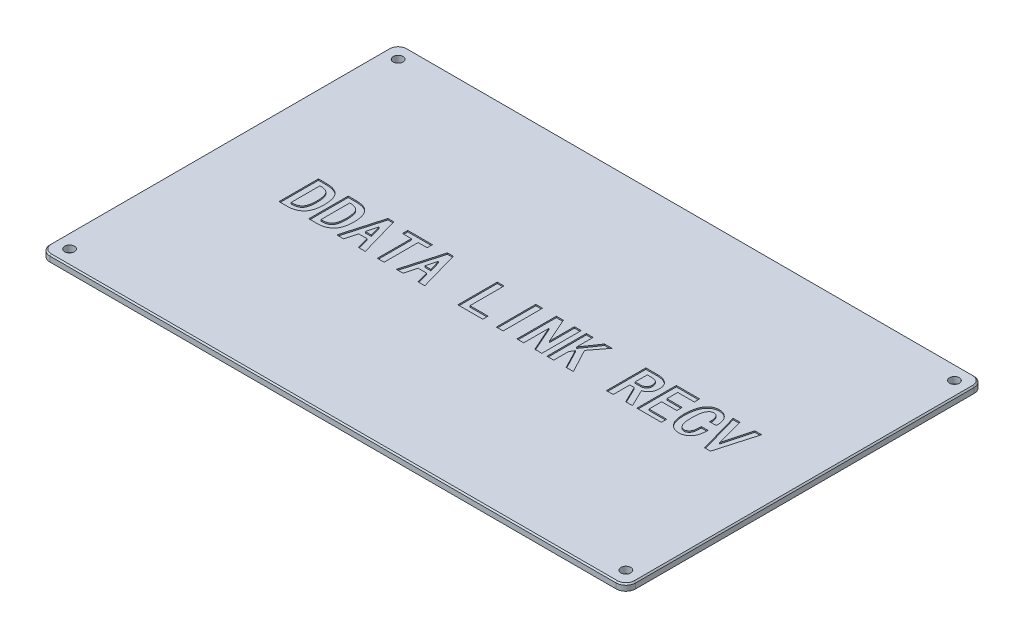
from build123d import *

# Parameters (mm, degrees)
SKETCH_1_W              = 180
SKETCH_1_H              = 110
EXTRUDE_1_DEPTH         = 2
SKETCH_2_R              = 1.5
CUT_EXTRUDE_1_DEPTH     = 2
FILLET_1_R              = 3
CHAMFER_1_SIZE          = 0.4
CUT_EXTRUDE_START       = -0.4
CUT_EXTRUDE_2_OUTLINE_W = 2.081871345
CUT_EXTRUDE_2_OUTLINE_H = 12.109161793
CUT_EXTRUDE_2_DEPTH     = 0.4


# Read off the part's stored shape, not the designer's step: 切除-拉伸2
with BuildPart() as part:
    # 草图1 → 凸台-拉伸1 (new body)
    with BuildSketch(Plane(origin=(0, 0, 0), x_dir=(1, 0, 0), z_dir=(0, 1, 0))):
        with Locations((90, 55)):
            Rectangle(SKETCH_1_W, SKETCH_1_H)
    extrude(amount=EXTRUDE_1_DEPTH)

    # 草图2 → 切除-拉伸1 (cut)
    with BuildSketch(Plane(origin=(0, 2, 0), x_dir=(1, 0, 0), z_dir=(0, 1, 0))):
        with Locations(Location((4.5, 105.5, 0), (0, 0, 270))):
            Circle(SKETCH_2_R)
        with Locations(Location((175.5, 105.5, 0), (0, 0, 270))):
            Circle(SKETCH_2_R)
        with Locations(Location((175.5, 4.5, 0), (0, 0, 270))):
            Circle(SKETCH_2_R)
        with Locations(Location((4.5, 4.5, 0), (0, 0, 270))):
            Circle(SKETCH_2_R)
    extrude(amount=-CUT_EXTRUDE_1_DEPTH, mode=Mode.SUBTRACT)

    # 圆角1
    fillet_1_edges = [part.edges().sort_by_distance(p)[0] for p in [
        (0, 1, -110),
        (180, 1, -110),
        (180, 1, 0),
        (0, 1, 0),
    ]]
    fillet(fillet_1_edges, radius=FILLET_1_R)

    # 倒角1
    chamfer_1_edges = [part.edges().sort_by_distance(p)[0] for p in [
        (0, 2, -55),
        (90, 2, -110),
        (90, 2, 0),
        (180, 2, -55),
        (179.121320344, 2, -0.878679656),
        (0.878679656, 2, -0.878679656),
        (179.121320344, 2, -109.121320344),
        (0.878679656, 2, -109.121320344),
    ]]
    chamfer(chamfer_1_edges, length=CHAMFER_1_SIZE)

    # 切除-拉伸2 outline → 切除-拉伸2 (cut)
    # profile 1 of 13: a face of its own
    with BuildSketch(Plane(origin=(0, 2, 0), x_dir=(1, 0, 0), z_dir=(0, 1, 0)).offset(CUT_EXTRUDE_START)):
        with BuildLine():
            add(Edge.make_bspline(
                [(150.95685727, 54.330020214), (150.948428937, 54.104573709), (150.932184848, 53.670066293), (150.862978184, 53.044455821), (150.76736325, 52.468824514), (150.634541592, 51.943961143), (150.472579151, 51.468953251), (150.277903446, 51.044851463), (150.05159863, 50.67039421), (149.78898881, 50.349533299), (149.502806077, 50.073047792), (149.20158679, 49.832073173), (148.881189049, 49.631791941), (148.547682408, 49.462140493), (148.193990079, 49.336657875), (147.825704445, 49.241020388), (147.439330699, 49.186351986), (147.176212548, 49.179501905), (147.04262725, 49.176024113)],
                knots=[0, 0, 0, 0, 0.092650065, 0.178566264, 0.258374813, 0.332177898, 0.400722959, 0.464258159, 0.523527298, 0.579945311, 0.634057603, 0.686750304, 0.73809523, 0.78902775, 0.840141494, 0.891933461, 0.945134531, 1, 1, 1, 1], degree=3))
            Line((150.95685727, 54.330020214), (148.872386835, 54.330020214))
            add(Edge.make_bspline(
                [(147.04262725, 50.816050104), (147.099105368, 50.81795417), (147.211202775, 50.821733349), (147.377686102, 50.855334281), (147.541847547, 50.905879587), (147.700251061, 50.983169253), (147.855546758, 51.078569957), (148.009941471, 51.191969399), (148.155863045, 51.332431625), (148.307191367, 51.488238472), (148.443752927, 51.683955185), (148.560556173, 51.925177341), (148.657307344, 52.212819236), (148.7362325, 52.546198895), (148.798163023, 52.925766987), (148.839710279, 53.352036708), (148.870037938, 53.82536447), (148.871580086, 54.156691797), (148.872386835, 54.330020214)],
                knots=[0, 0, 0, 0, 0.038312895, 0.076043189, 0.114929958, 0.154666353, 0.195328327, 0.238628562, 0.28441907, 0.33270403, 0.385913323, 0.445638287, 0.514105762, 0.591587255, 0.678053732, 0.775054573, 0.882323517, 1, 1, 1, 1], degree=3))
            add(Edge.make_bspline(
                [(145.033530434, 55.127940942), (145.035852871, 54.929518304), (145.040307142, 54.548957639), (145.064829175, 54.002595303), (145.110208931, 53.504460795), (145.178390293, 53.055407378), (145.258369261, 52.653122025), (145.362016109, 52.300883251), (145.482759355, 51.995894574), (145.624745767, 51.738020659), (145.779862083, 51.520290136), (145.942469783, 51.334587852), (146.108385098, 51.174938827), (146.280274899, 51.041912679), (146.462763602, 50.94297518), (146.649768549, 50.8682944), (146.845008466, 50.826346239), (146.97660233, 50.819490068), (147.04262725, 50.816050104)],
                knots=[0, 0, 0, 0, 0.113581278, 0.217840904, 0.312979872, 0.399736211, 0.477738056, 0.547563165, 0.609631518, 0.665120556, 0.715620908, 0.762365755, 0.80621126, 0.847273292, 0.88633722, 0.924647863, 0.962193382, 1, 1, 1, 1], degree=3))
            add(Edge.make_bspline(
                [(147.110203599, 59.920663489), (147.039756494, 59.917818794), (146.898835592, 59.912128325), (146.692088437, 59.861150306), (146.494953359, 59.77584193), (146.304218558, 59.659602566), (146.124577357, 59.507715691), (145.949697742, 59.325868918), (145.788300776, 59.108356259), (145.629483693, 58.859525025), (145.484288094, 58.567493157), (145.365272234, 58.224474177), (145.261853663, 57.832534562), (145.176795297, 57.389707425), (145.114008768, 56.895652263), (145.067909338, 56.351095833), (145.03950547, 55.756352902), (145.035573648, 55.342831747), (145.033530434, 55.127940942)],
                knots=[0, 0, 0, 0, 0.036893459, 0.073800897, 0.110839474, 0.149167472, 0.190459983, 0.23383125, 0.281162835, 0.332200621, 0.388470209, 0.451688237, 0.522203748, 0.600864324, 0.687911971, 0.783197544, 0.887336225, 1, 1, 1, 1], degree=3))
            add(Edge.make_bspline(
                [(148.872386835, 56.890124178), (148.87081773, 57.02097837), (148.867781369, 57.274193282), (148.846694341, 57.639201329), (148.814966562, 57.975273785), (148.764403871, 58.281302), (148.704645888, 58.559219546), (148.626029051, 58.807581255), (148.535939485, 59.027447784), (148.431548988, 59.219413944), (148.313073508, 59.386366568), (148.180590021, 59.529037057), (148.035399757, 59.651412153), (147.876306659, 59.75071685), (147.702518284, 59.826247646), (147.516540938, 59.880531825), (147.317729872, 59.915825106), (147.180533833, 59.919023771), (147.110203599, 59.920663489)],
                knots=[0, 0, 0, 0, 0.099081693, 0.1917322, 0.276790095, 0.354552367, 0.426492845, 0.491850436, 0.551550139, 0.606159369, 0.656950648, 0.706158073, 0.753196694, 0.800344983, 0.847639102, 0.896212702, 0.946795949, 1, 1, 1, 1], degree=3))
            Line((148.872386835, 56.890124178), (150.87628547, 56.890124178))
            add(Edge.make_bspline(
                [(147.110203599, 61.56068948), (147.249913876, 61.557638266), (147.523631227, 61.551660393), (147.923875955, 61.491610192), (148.304558976, 61.400363019), (148.6644446, 61.265829659), (149.003323395, 61.093677287), (149.322271574, 60.884363932), (149.620631192, 60.638101047), (149.896398082, 60.354969521), (150.142911892, 60.034825868), (150.357536139, 59.68228473), (150.53413958, 59.296233049), (150.67850175, 58.87894659), (150.779929374, 58.426163319), (150.850046496, 57.942255972), (150.883450131, 57.425995769), (150.878718385, 57.072090942), (150.87628547, 56.890124178)],
                knots=[0, 0, 0, 0, 0.061456112, 0.120403484, 0.177748885, 0.233497151, 0.289096522, 0.3447325, 0.401080158, 0.459062378, 0.518330837, 0.578566775, 0.640333288, 0.704854402, 0.772569296, 0.844244707, 0.919915513, 1, 1, 1, 1], degree=3))
            add(Edge.make_bspline(
                [(142.881483651, 54.990189155), (142.884841177, 55.256247613), (142.891345071, 55.771631871), (142.945069955, 56.519053843), (143.039164072, 57.21391627), (143.163177018, 57.858588308), (143.330395566, 58.449919669), (143.529078658, 58.992334866), (143.766956049, 59.482949938), (144.044985643, 59.918947108), (144.348419772, 60.30541337), (144.678132455, 60.639706308), (145.026608084, 60.927405419), (145.402355863, 61.156910428), (145.797578461, 61.337819368), (146.214291628, 61.469787693), (146.65519079, 61.545622313), (146.956569023, 61.555602067), (147.110203599, 61.56068948)],
                knots=[0, 0, 0, 0, 0.091141557, 0.176551138, 0.256514057, 0.331252505, 0.401252856, 0.466803535, 0.528925032, 0.587632368, 0.643627142, 0.696935755, 0.74820333, 0.798038489, 0.847312801, 0.896782485, 0.947382467, 1, 1, 1, 1], degree=3))
            add(Edge.make_bspline(
                [(147.04262725, 49.176024113), (146.900281348, 49.179662904), (146.620112345, 49.186824871), (146.208593894, 49.254275773), (145.813376211, 49.363141115), (145.434877663, 49.518469335), (145.071256407, 49.713568363), (144.725991144, 49.9554722), (144.398866627, 50.241266716), (144.083879885, 50.56502738), (143.799961056, 50.941300062), (143.551733103, 51.369740268), (143.341642653, 51.849137328), (143.17485533, 52.380600232), (143.042755423, 52.960396985), (142.947882004, 53.5910195), (142.890428331, 54.273498855), (142.884534297, 54.745756857), (142.881483651, 54.990189155)],
                knots=[0, 0, 0, 0, 0.053030573, 0.104376189, 0.154996494, 0.205555973, 0.256567325, 0.308532886, 0.362341603, 0.418305492, 0.476635009, 0.537568319, 0.602498769, 0.671341306, 0.744909024, 0.823976774, 0.908893526, 1, 1, 1, 1], degree=3))
        make_face()
    # profile 2 of 13: a face of its own
    with BuildSketch(Plane(origin=(0, 2, 0), x_dir=(1, 0, 0), z_dir=(0, 1, 0)).offset(CUT_EXTRUDE_START)):
        with BuildLine():
            add(Edge.make_bspline(
                [(128.331776048, 61.422937693), (128.478295799, 61.420758208), (128.765888065, 61.416480264), (129.18620146, 61.373691642), (129.585721904, 61.306453827), (129.96377815, 61.214481049), (130.319516775, 61.09038333), (130.655112845, 60.94349086), (130.969681659, 60.768193195), (131.260254456, 60.566179144), (131.526119612, 60.337611961), (131.756428692, 60.074897502), (131.952286644, 59.782313731), (132.111681601, 59.459765657), (132.233566009, 59.107583849), (132.321793256, 58.726129728), (132.373333351, 58.314099853), (132.380213991, 58.029539237), (132.383757855, 57.88297668)],
                knots=[0, 0, 0, 0, 0.071797487, 0.140925724, 0.206828829, 0.270272655, 0.331376729, 0.391266126, 0.449629048, 0.507587352, 0.564473205, 0.621039575, 0.678279369, 0.73658201, 0.796884002, 0.860542064, 0.92817238, 1, 1, 1, 1], degree=3))
            Line((128.331776048, 61.422937693), (124.721639596, 61.422937693))
            Line((124.721639596, 61.422937693), (124.721639596, 49.3137759))
            Line((124.721639596, 49.3137759), (126.803510941, 49.3137759))
            Line((126.803510941, 49.3137759), (126.803510941, 54.410592014))
            Line((126.803510941, 54.410592014), (128.157636997, 54.410592014))
            Line((128.157636997, 54.410592014), (130.637169161, 49.3137759))
            Line((130.637169161, 49.3137759), (132.726837777, 49.3137759))
            Line((132.726837777, 49.3137759), (130.109553826, 54.688694678))
            add(Edge.make_bspline(
                [(132.383757855, 57.88297668), (132.382419972, 57.769355261), (132.379818387, 57.548412329), (132.340592531, 57.22638752), (132.285466391, 56.921673533), (132.20444958, 56.634572892), (132.101558839, 56.365651764), (131.971521767, 56.11737206), (131.824769897, 55.882985321), (131.594830563, 55.608686908), (131.292688423, 55.308341215), (130.909020679, 55.019568582), (130.517671433, 54.803712922), (130.243099793, 54.726331434), (130.109553826, 54.688694678)],
                knots=[0, 0, 0, 0, 0.080408974, 0.156359555, 0.229399722, 0.299516036, 0.367306859, 0.43288785, 0.497730006, 0.562696851, 0.685906571, 0.798549465, 0.902018626, 1, 1, 1, 1], degree=3))
        make_face()
        with BuildLine():
            add(Edge.make_bspline(
                [(128.399352397, 56.050618005), (128.524471648, 56.055601958), (128.768430513, 56.065319723), (129.121067642, 56.141319554), (129.444817963, 56.271426221), (129.693583852, 56.417356644), (129.870846759, 56.564511444), (129.98730191, 56.696442594), (130.082505929, 56.849441794), (130.164678246, 57.018529832), (130.223149998, 57.209125378), (130.266355964, 57.417081554), (130.296695658, 57.643855589), (130.298403591, 57.801432896), (130.299287419, 57.88297668)],
                knots=[0, 0, 0, 0, 0.124547931, 0.242844898, 0.357085452, 0.470878725, 0.528437209, 0.58590508, 0.645265586, 0.707401916, 0.772619012, 0.843187358, 0.918851918, 1, 1, 1, 1], degree=3))
            Line((128.399352397, 56.050618005), (126.803510941, 56.050618005))
            Line((126.803510941, 56.050618005), (126.803510941, 59.782911702))
            Line((126.803510941, 59.782911702), (127.986097036, 59.782911702))
            add(Edge.make_bspline(
                [(130.299287419, 57.88297668), (130.298082738, 57.954971273), (130.295723036, 58.095992575), (130.268745523, 58.301184421), (130.227160022, 58.495078926), (130.170945977, 58.677820052), (130.095169869, 58.848042572), (130.001033836, 59.00464429), (129.890180564, 59.148312536), (129.766119258, 59.283408879), (129.617595729, 59.400100322), (129.451482639, 59.50552863), (129.260618754, 59.590114944), (129.050002176, 59.664114365), (128.814329069, 59.716951733), (128.557212531, 59.755304438), (128.278494473, 59.778825788), (128.085775621, 59.78151881), (127.986097036, 59.782911702)],
                knots=[0, 0, 0, 0, 0.062951443, 0.123307794, 0.180692636, 0.236308236, 0.290256402, 0.343291675, 0.395744214, 0.448828209, 0.503279857, 0.560484211, 0.620516063, 0.685475163, 0.755523602, 0.83141769, 0.912805385, 1, 1, 1, 1], degree=3))
        make_face(mode=Mode.SUBTRACT)
    # profile 3 of 13: a face of its own
    with BuildSketch(Plane(origin=(0, 2, 0), x_dir=(1, 0, 0), z_dir=(0, 1, 0)).offset(CUT_EXTRUDE_START)):
        with BuildLine():
            add(Edge.make_bspline(
                [(35.741782546, 61.422937693), (35.962875605, 61.418475838), (36.391420697, 61.409827416), (37.011577689, 61.34260833), (37.585823456, 61.229120471), (38.114046032, 61.071378022), (38.597084468, 60.868379691), (39.034696131, 60.618450658), (39.425079962, 60.319955532), (39.770082382, 59.974619451), (40.072544709, 59.580262328), (40.329101667, 59.130151985), (40.550264388, 58.629709864), (40.729393092, 58.07390657), (40.864489889, 57.464469084), (40.962031956, 56.801730784), (41.022087973, 56.085508996), (41.029627765, 55.589834846), (41.033530434, 55.333269077)],
                knots=[0, 0, 0, 0, 0.071201178, 0.138009377, 0.200615386, 0.259496855, 0.315264295, 0.369016079, 0.421367624, 0.473064341, 0.525807093, 0.580944039, 0.639536507, 0.701748872, 0.768699696, 0.840366328, 0.917372057, 1, 1, 1, 1], degree=3))
            Line((35.741782546, 61.422937693), (33.233660389, 61.422937693))
            Line((33.233660389, 61.422937693), (33.233660389, 49.3137759))
            Line((33.233660389, 49.3137759), (35.741782546, 49.3137759))
            add(Edge.make_bspline(
                [(41.033530434, 55.333269077), (41.028809667, 55.076704788), (41.019687, 54.580906025), (40.956550784, 53.864730904), (40.844306714, 53.204662114), (40.693964242, 52.597848958), (40.493671863, 52.046262925), (40.249619043, 51.549676548), (39.962609591, 51.106493976), (39.627106055, 50.721912993), (39.250592449, 50.391883007), (38.847583262, 50.100273333), (38.408389551, 49.858346159), (37.93912912, 49.655988009), (37.434307233, 49.505197247), (36.899145067, 49.391900688), (36.330721634, 49.327974848), (35.94119925, 49.31858371), (35.741782546, 49.3137759)],
                knots=[0, 0, 0, 0, 0.083884036, 0.162102066, 0.234794836, 0.302603191, 0.366226687, 0.426272698, 0.483153898, 0.538366567, 0.592541318, 0.646543992, 0.700689114, 0.756145388, 0.813312224, 0.87264444, 0.934800086, 1, 1, 1, 1], degree=3))
        make_face()
        with BuildLine():
            add(Edge.make_bspline(
                [(35.741782546, 50.953801891), (35.869284045, 50.956750095), (36.116425199, 50.962464715), (36.474715815, 51.007817809), (36.808954221, 51.078494748), (37.11729813, 51.183279454), (37.401674343, 51.316044108), (37.660239311, 51.481381728), (37.895776973, 51.674301882), (38.107935812, 51.89925131), (38.295929506, 52.163646243), (38.453121068, 52.476271785), (38.584001762, 52.836450933), (38.695947539, 53.242910591), (38.779808846, 53.698647995), (38.837645925, 54.201438853), (38.874321931, 54.751399424), (38.879030327, 55.133943443), (38.881483651, 55.333269077)],
                knots=[0, 0, 0, 0, 0.06157925, 0.119361476, 0.17420375, 0.226354123, 0.276345084, 0.325461037, 0.374229775, 0.423086444, 0.474419126, 0.530390201, 0.591577019, 0.659307146, 0.733845725, 0.815199008, 0.903708925, 1, 1, 1, 1], degree=3))
            Line((35.741782546, 50.953801891), (35.315531734, 50.953801891))
            Line((35.315531734, 50.953801891), (35.315531734, 59.782911702))
            Line((35.315531734, 59.782911702), (35.741782546, 59.782911702))
            add(Edge.make_bspline(
                [(38.881483651, 55.333269077), (38.879032694, 55.533461745), (38.874328002, 55.91773808), (38.8376025, 56.470280816), (38.779907673, 56.975705198), (38.695405919, 57.43471054), (38.584198375, 57.84685406), (38.450601669, 58.212417744), (38.292691869, 58.531636862), (38.10561602, 58.803514318), (37.893394393, 59.035099282), (37.66112368, 59.23794261), (37.401176207, 59.407897377), (37.116098504, 59.545579255), (36.807232173, 59.652555892), (36.474060905, 59.726560297), (36.116595727, 59.774903474), (35.869304703, 59.780187074), (35.741782546, 59.782911702)],
                knots=[0, 0, 0, 0, 0.095937682, 0.184155499, 0.265271805, 0.339623548, 0.407614047, 0.469624787, 0.525889424, 0.577833102, 0.627214304, 0.676079586, 0.725254369, 0.775579675, 0.82744862, 0.881538554, 0.938912222, 1, 1, 1, 1], degree=3))
        make_face(mode=Mode.SUBTRACT)
    # profile 4 of 13: a face of its own
    with BuildSketch(Plane(origin=(0, 2, 0), x_dir=(1, 0, 0), z_dir=(0, 1, 0)).offset(CUT_EXTRUDE_START)):
        with BuildLine():
            add(Edge.make_bspline(
                [(26.592984625, 61.422937693), (26.814077685, 61.418475838), (27.242622776, 61.409827416), (27.862779768, 61.34260833), (28.437025535, 61.229120471), (28.965248112, 61.071378022), (29.448286547, 60.868379691), (29.88589821, 60.618450658), (30.276282041, 60.319955532), (30.621284462, 59.974619451), (30.923746788, 59.580262328), (31.180303747, 59.130151985), (31.401466468, 58.629709864), (31.580595172, 58.07390657), (31.715691968, 57.464469084), (31.813234035, 56.801730784), (31.873290052, 56.085508996), (31.880829844, 55.589834846), (31.884732514, 55.333269077)],
                knots=[0, 0, 0, 0, 0.071201178, 0.138009377, 0.200615386, 0.259496855, 0.315264295, 0.369016079, 0.421367624, 0.473064341, 0.525807093, 0.580944039, 0.639536507, 0.701748872, 0.768699696, 0.840366328, 0.917372057, 1, 1, 1, 1], degree=3))
            Line((26.592984625, 61.422937693), (24.084862468, 61.422937693))
            Line((24.084862468, 61.422937693), (24.084862468, 49.3137759))
            Line((24.084862468, 49.3137759), (26.592984625, 49.3137759))
            add(Edge.make_bspline(
                [(31.884732514, 55.333269077), (31.880011746, 55.076704788), (31.87088908, 54.580906025), (31.807752863, 53.864730904), (31.695508793, 53.204662114), (31.545166321, 52.597848958), (31.344873942, 52.046262925), (31.100821123, 51.549676548), (30.81381167, 51.106493976), (30.478308135, 50.721912993), (30.101794528, 50.391883007), (29.698785341, 50.100273333), (29.25959163, 49.858346159), (28.790331199, 49.655988009), (28.285509313, 49.505197247), (27.750347146, 49.391900688), (27.181923713, 49.327974848), (26.792401329, 49.31858371), (26.592984625, 49.3137759)],
                knots=[0, 0, 0, 0, 0.083884036, 0.162102066, 0.234794836, 0.302603191, 0.366226687, 0.426272698, 0.483153898, 0.538366567, 0.592541318, 0.646543992, 0.700689114, 0.756145388, 0.813312224, 0.87264444, 0.934800086, 1, 1, 1, 1], degree=3))
        make_face()
        with BuildLine():
            add(Edge.make_bspline(
                [(26.592984625, 50.953801891), (26.720486124, 50.956750095), (26.967627279, 50.962464715), (27.325917894, 51.007817809), (27.660156301, 51.078494748), (27.968500209, 51.183279454), (28.252876423, 51.316044108), (28.511441391, 51.481381728), (28.746979052, 51.674301882), (28.959137891, 51.89925131), (29.147131585, 52.163646243), (29.304323148, 52.476271785), (29.435203841, 52.836450933), (29.547149618, 53.242910591), (29.631010926, 53.698647995), (29.688848005, 54.201438853), (29.72552401, 54.751399424), (29.730232407, 55.133943443), (29.73268573, 55.333269077)],
                knots=[0, 0, 0, 0, 0.06157925, 0.119361476, 0.17420375, 0.226354123, 0.276345084, 0.325461037, 0.374229775, 0.423086444, 0.474419126, 0.530390201, 0.591577019, 0.659307146, 0.733845725, 0.815199008, 0.903708925, 1, 1, 1, 1], degree=3))
            Line((26.592984625, 50.953801891), (26.166733813, 50.953801891))
            Line((26.166733813, 50.953801891), (26.166733813, 59.782911702))
            Line((26.166733813, 59.782911702), (26.592984625, 59.782911702))
            add(Edge.make_bspline(
                [(29.73268573, 55.333269077), (29.730234773, 55.533461745), (29.725530081, 55.91773808), (29.688804579, 56.470280816), (29.631109752, 56.975705198), (29.546607998, 57.43471054), (29.435400454, 57.84685406), (29.301803748, 58.212417744), (29.143893948, 58.531636862), (28.9568181, 58.803514318), (28.744596472, 59.035099282), (28.51232576, 59.23794261), (28.252378287, 59.407897377), (27.967300583, 59.545579255), (27.658434252, 59.652555892), (27.325262984, 59.726560297), (26.967797806, 59.774903474), (26.720506782, 59.780187074), (26.592984625, 59.782911702)],
                knots=[0, 0, 0, 0, 0.095937682, 0.184155499, 0.265271805, 0.339623548, 0.407614047, 0.469624787, 0.525889424, 0.577833102, 0.627214304, 0.676079586, 0.725254369, 0.775579675, 0.82744862, 0.881538554, 0.938912222, 1, 1, 1, 1], degree=3))
        make_face(mode=Mode.SUBTRACT)
    # profile 5 of 13: a face of its own
    with BuildSketch(Plane(origin=(0, 2, 0), x_dir=(1, 0, 0), z_dir=(0, 1, 0)).offset(CUT_EXTRUDE_START)):
        Polygon((160.310983326, 61.422937693), (158.197922897, 61.422937693), (155.924944854, 52.912142886), (153.64951484, 61.422937693), (151.546850772, 61.422937693), (155.029631799, 49.176024113), (156.817805938, 49.176024113), align=None)
    # profile 6 of 13: a face of its own
    with BuildSketch(Plane(origin=(0, 2, 0), x_dir=(1, 0, 0), z_dir=(0, 1, 0)).offset(CUT_EXTRUDE_START)):
        Polygon((141.257052202, 61.422937693), (134.075765652, 61.422937693), (134.075765652, 49.3137759), (141.600132124, 49.3137759), (141.600132124, 50.953801891), (136.160236087, 50.953801891), (136.160236087, 54.823847375), (140.843796841, 54.823847375), (140.843796841, 56.463873366), (136.160236087, 56.463873366), (136.160236087, 59.782911702), (141.257052202, 59.782911702), align=None)
    # profile 7 of 13: a face of its own
    with BuildSketch(Plane(origin=(0, 2, 0), x_dir=(1, 0, 0), z_dir=(0, 1, 0)).offset(CUT_EXTRUDE_START)):
        Polygon((108.5059151, 61.422937693), (106.424043755, 61.422937693), (106.424043755, 49.3137759), (108.5059151, 49.3137759), (108.5059151, 53.880377589), (109.303835827, 55.166927297), (112.34217241, 49.3137759), (114.566993722, 49.3137759), (110.642367341, 56.638012417), (114.291490148, 61.422937693), (112.01728612, 61.422937693), (108.5059151, 56.326121579), align=None)
    # profile 8 of 13: a face of its own
    with BuildSketch(Plane(origin=(0, 2, 0), x_dir=(1, 0, 0), z_dir=(0, 1, 0)).offset(CUT_EXTRUDE_START)):
        Polygon((99.351918998, 61.422937693), (97.205070395, 61.422937693), (97.205070395, 49.3137759), (99.289540831, 49.3137759), (99.289540831, 57.010869571), (102.704745509, 49.3137759), (104.867188654, 49.3137759), (104.867188654, 61.422937693), (102.785317309, 61.422937693), (102.785317309, 53.679528737), align=None)
    # profile 9 of 13: a face of its own
    with BuildSketch(Plane(origin=(0, 2, 0), x_dir=(1, 0, 0), z_dir=(0, 1, 0)).offset(CUT_EXTRUDE_START)):
        with Locations((91.922419324, 55.368356797)):
            Rectangle(CUT_EXTRUDE_2_OUTLINE_W, CUT_EXTRUDE_2_OUTLINE_H)
    # profile 10 of 13: a face of its own
    with BuildSketch(Plane(origin=(0, 2, 0), x_dir=(1, 0, 0), z_dir=(0, 1, 0)).offset(CUT_EXTRUDE_START)):
        Polygon((81.129696776, 61.422937693), (79.045226341, 61.422937693), (79.045226341, 49.3137759), (86.707344599, 49.3137759), (86.707344599, 50.953801891), (81.129696776, 50.953801891), align=None)
    # profile 11 of 13: a face of its own
    with BuildSketch(Plane(origin=(0, 2, 0), x_dir=(1, 0, 0), z_dir=(0, 1, 0)).offset(CUT_EXTRUDE_START)):
        Polygon((59.12319905, 61.422937693), (51.53125623, 61.422937693), (51.53125623, 59.782911702), (54.286291968, 59.782911702), (54.286291968, 49.3137759), (56.368163313, 49.3137759), (56.368163313, 59.782911702), (59.12319905, 59.782911702), align=None)
    # profile 12 of 13: a face of its own
    with BuildSketch(Plane(origin=(0, 2, 0), x_dir=(1, 0, 0), z_dir=(0, 1, 0)).offset(CUT_EXTRUDE_START)):
        Polygon((66.777520038, 49.3137759), (68.893179557, 49.3137759), (65.397403079, 61.56068948), (63.61442712, 61.56068948), (60.129047004, 49.3137759), (62.234310161, 49.3137759), (63.19857267, 52.962898707), (65.81325753, 52.962898707), align=None)
        Polygon((65.431191253, 54.605523788), (63.588436217, 54.605523788), (64.505297179, 57.965841794), align=None, mode=Mode.SUBTRACT)
    # profile 13 of 13: a face of its own
    with BuildSketch(Plane(origin=(0, 2, 0), x_dir=(1, 0, 0), z_dir=(0, 1, 0)).offset(CUT_EXTRUDE_START)):
        Polygon((48.479924197, 49.3137759), (50.595583716, 49.3137759), (47.099807237, 61.56068948), (45.316831279, 61.56068948), (41.831451162, 49.3137759), (43.93671432, 49.3137759), (44.900976828, 52.962898707), (47.515661688, 52.962898707), align=None)
        Polygon((47.133595412, 54.605523788), (45.290840376, 54.605523788), (46.207701337, 57.965841794), align=None, mode=Mode.SUBTRACT)
    extrude(amount=CUT_EXTRUDE_2_DEPTH, mode=Mode.SUBTRACT)


solid = part.part
